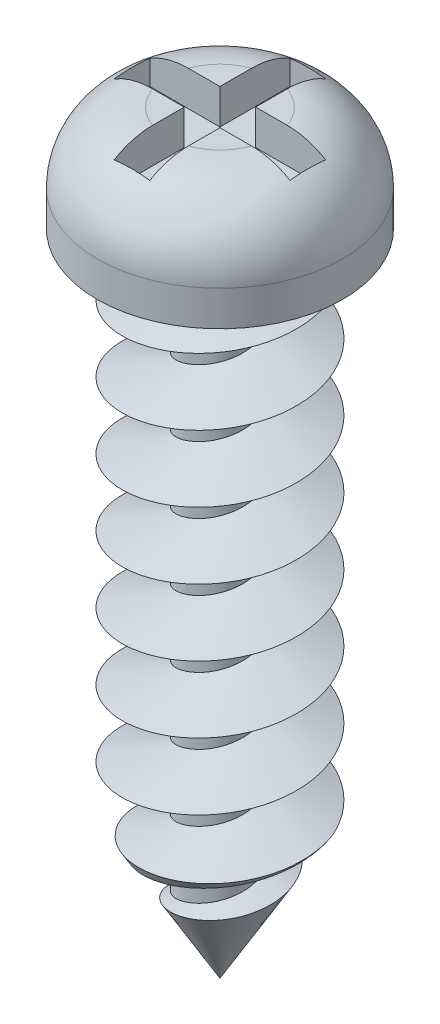
from build123d import *
from build123d.topology import SkipClean

# Parameters (mm, degrees)
ESBO_O1_R                = 3.5
RESSALTO_EXTRUS_O1_DEPTH = 2
ESBO_O2_R                = 1
RESSALTO_EXTRUS_O2_DEPTH = 18.5
ESBO_O4_R                = 3.5
RESSALTO_EXTRUS_O3_DEPTH = 1
FILETE1_R                = 2
CORTE_EXTRUS_O1_DEPTH    = 1
VARREDURA1_PITCH         = 1.9


with BuildPart() as part:
    # Esboço1 → Ressalto-extrusão1 (new body)
    with BuildSketch(Plane(origin=(0, 0, 0), x_dir=(1, 0, 0), z_dir=(0, 1, 0))):
        with Locations(Location((0, 0, 0), (0, 0, 270))):
            Circle(ESBO_O1_R)
    extrude(amount=RESSALTO_EXTRUS_O1_DEPTH)

    # Esboço2 → Ressalto-extrusão2 (add)
    with BuildSketch(Plane.XZ):
        with Locations(Location((0, 0, 0), (0, 0, 270))):
            Circle(ESBO_O2_R)
    extrude(amount=RESSALTO_EXTRUS_O2_DEPTH)

    # Esboço4 → Ressalto-extrusão3 (add)
    with BuildSketch(Plane(origin=(0, 2, 0), x_dir=(1, 0, 0), z_dir=(0, 1, 0))):
        with Locations(Location((0, 0, 0), (0, 0, 270))):
            Circle(ESBO_O4_R)
    extrude(amount=RESSALTO_EXTRUS_O3_DEPTH)

    # Filete1
    filete1_edges = [part.edges().sort_by_distance(p)[0] for p in [
        (0, 3, -3.5),
    ]]
    fillet(filete1_edges, radius=FILETE1_R)

    # Esboço5 → Corte-extrusão1 (cut)
    with BuildSketch(Plane(origin=(0, 3, 0), x_dir=(1, 0, 0), z_dir=(0, 1, 0))):
        Polygon((-0.509084499, 2.506635104), (0.509084499, 2.506635104), (0.509084499, 0.509084499), (2.506635104, 0.509084499), (2.506635104, -0.509084499), (0.509084499, -0.509084499), (0.509084499, -2.506635104), (-0.509084499, -2.506635104), (-0.509084499, -0.509084499), (-2.506635104, -0.509084499), (-2.506635104, 0.509084499), (-0.509084499, 0.509084499), align=None)
    extrude(amount=-CORTE_EXTRUS_O1_DEPTH, mode=Mode.SUBTRACT)

    # Varredura1: the profile of Esboço8 profile screwed along a right-hand helix of 10.5 turns, 10 arcs to a turn; built about Z, then put on its axis
    varredura1_z = Axis((0, 0, 0), (0, 0, 1))
    varredura1_corners = [(0.9997, 0, 0.00012), (0.9997, 0, -1.20012), (2.5, 0, -0.6)]
    with BuildLine(mode=Mode.PRIVATE) as varredura1_profile:
        Line(varredura1_corners[0], varredura1_corners[1])
        Line(varredura1_corners[1], varredura1_corners[2])
        Line(varredura1_corners[2], varredura1_corners[0])
    varredura1_cap = Face(varredura1_profile.wire())
    varredura1_turn_angles = [0, 18, 36, 54, 72, 90, 108, 126, 144, 162, 180, 198, 216, 234, 252, 270, 288, 306, 324, 342, 360]
    varredura1_turn_weights = [1, 0.9510565162951535, 1, 0.9510565162951535, 1, 0.9510565162951535, 1, 0.9510565162951535, 1, 0.9510565162951535, 1, 0.9510565162951535, 1, 0.9510565162951535, 1, 0.9510565162951535, 1, 0.9510565162951535, 1, 0.9510565162951535, 1]
    varredura1_turn_rails = [Edge.make_bspline([Vector(p[0], p[1], 0).rotate(varredura1_z, varredura1_turn_angles[k]) / varredura1_turn_weights[k] + Vector(0, 0, p[2] + VARREDURA1_PITCH * varredura1_turn_angles[k] / 360) for k in range(21)], [0, 0, 0, 1, 1, 2, 2, 3, 3, 4, 4, 5, 5, 6, 6, 7, 7, 8, 8, 9, 9, 10, 10, 10], 2, varredura1_turn_weights) for p in varredura1_corners]
    varredura1_turn_sides = [Face.make_surface_from_curves(varredura1_turn_rails[p[0]], varredura1_turn_rails[p[1]]) for p in [(0, 1), (1, 2), (2, 0)]]
    varredura1_last_angles = [3600, 3618, 3636, 3654, 3672, 3690, 3708, 3726, 3744, 3762, 3780]
    varredura1_last_weights = [1, 0.9510565162951535, 1, 0.9510565162951535, 1, 0.9510565162951535, 1, 0.9510565162951535, 1, 0.9510565162951401, 1]
    varredura1_last_rails = [Edge.make_bspline([Vector(p[0], p[1], 0).rotate(varredura1_z, varredura1_last_angles[k]) / varredura1_last_weights[k] + Vector(0, 0, p[2] + VARREDURA1_PITCH * varredura1_last_angles[k] / 360) for k in range(11)], [0, 0, 0, 1, 1, 2, 2, 3, 3, 4, 4, 5, 5, 5], 2, varredura1_last_weights) for p in varredura1_corners]
    varredura1_last_sides = [Face.make_surface_from_curves(varredura1_last_rails[p[0]], varredura1_last_rails[p[1]]) for p in [(0, 1), (1, 2), (2, 0)]]
    varredura1 = Plane(origin=(0, -18.5, 0), x_dir=(-1, 0, 0), z_dir=(0, 1, 0)) * Solid(Shell([*[p.moved(Location((0, 0, VARREDURA1_PITCH * i))) for i in range(10) for p in varredura1_turn_sides], *varredura1_last_sides, varredura1_cap, varredura1_cap.rotate(varredura1_z, 3780).moved(Location((0, 0, VARREDURA1_PITCH * 3780 / 360)))]))
    add(varredura1)

    # Esboço10 → Corte-Revolução1 (revolve, cut)
    with SkipClean():  # the faces are left unmerged after this step: merging them gives an invalid solid
        with BuildSketch(Plane.XY, mode=Mode.PRIVATE) as corte_revolu_o1_sk:
            Polygon((0, -18.510926479), (-4.57447737, -10.689891237), (-7.31320775, -12.291758479), (-2.215601487, -21.978946321), (0, -20.499238618), align=None)
        revolve(corte_revolu_o1_sk.sketch.rotate(Axis((0, -20.499238618, 0), (0, 1, 0)), 189.353977522), axis=Axis((0, -20.499238618, 0), (0, 1, 0)), mode=Mode.SUBTRACT)


solid = part.part
